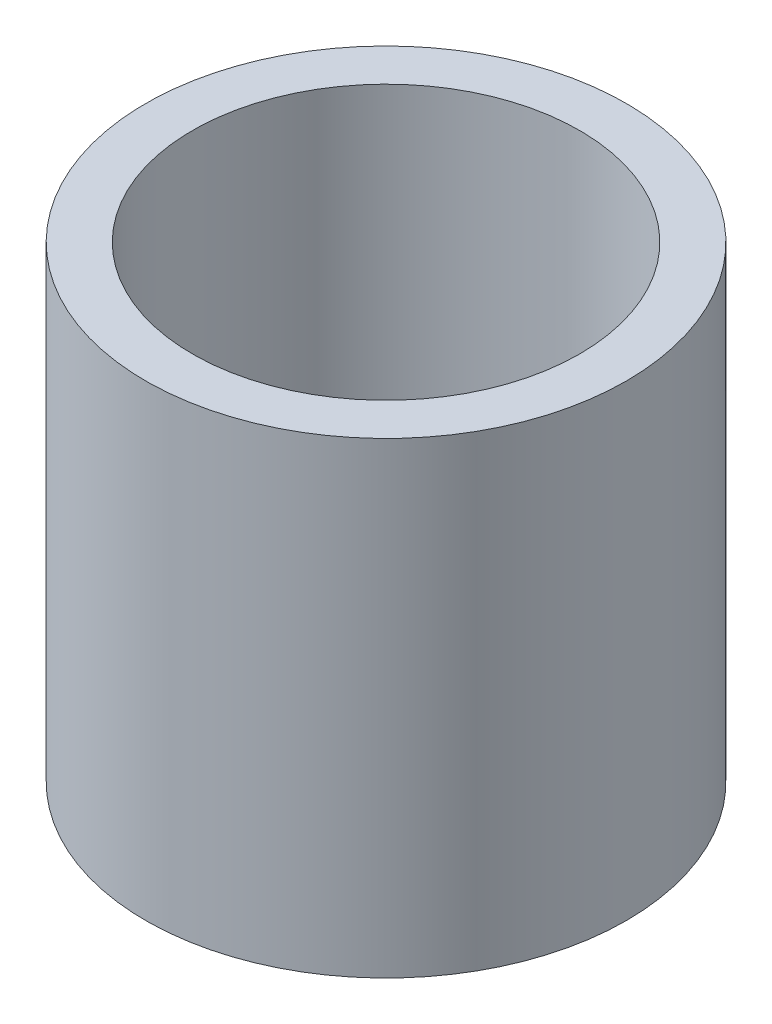
from build123d import *


with BuildPart() as part:
    # Sketch1 → Revolve1 (revolve)
    with BuildSketch(Plane.XY):
        Polygon((16, -17.5), (16, -4.5), (14.5, -4.5), (14.5, 17.5), (18, 17.5), (18, -17.5), align=None)
    revolve(axis=Axis((0, -1459.892614339, 0), (0, 1, 0)))


solid = part.part
